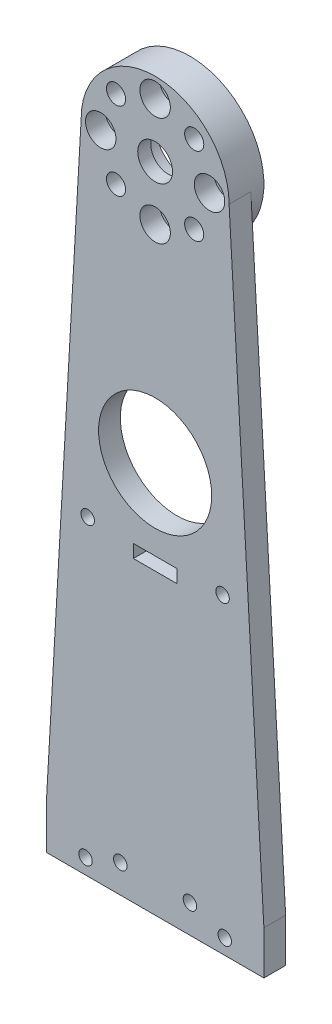
from build123d import *
from build123d.topology import SkipClean

# Parameters (mm, degrees)
SKETCH1_R           = 4
SKETCH1_R_2         = 13
SKETCH1_R_3         = 1.55
SKETCH1_W           = 10
SKETCH1_H           = 3
BOSS_EXTRUDE1_DEPTH = 5
BOSS_EXTRUDE2_START = 3
SKETCH2_R           = 17
BOSS_EXTRUDE2_DEPTH = 3
SKETCH3_R           = 1.55
SKETCH3_R_2         = 1
CUT_EXTRUDE1_DEPTH  = 8
SKETCH4_R           = 3.5
SKETCH4_R_2         = 2.2
CUT_EXTRUDE2_DEPTH  = 4.5
SKETCH5_R           = 8.2
CUT_EXTRUDE3_DEPTH  = 5


with BuildPart() as part:
    # Sketch1 → Boss-Extrude1 (new body)
    with BuildSketch(Plane.XY):
        with BuildLine():
            Line((-25, 0), (25, 0))
            Line((25, 0), (25, 10))
            Line((25, 10), (17, 150))
            ThreePointArc((17, 150), (0, 167), (-17, 150))
            Line((-17, 150), (-25, 10))
            Line((-25, 10), (-25, 0))
        make_face()
        with Locations((0, 150)):
            Circle(SKETCH1_R, mode=Mode.SUBTRACT)
        with Locations((0, 90)):
            Circle(SKETCH1_R_2, mode=Mode.SUBTRACT)
        with Locations((-8, 6.5)):
            Circle(SKETCH1_R_3, mode=Mode.SUBTRACT)
        with Locations((-16, 3.5)):
            Circle(SKETCH1_R_3, mode=Mode.SUBTRACT)
        with Locations((8, 6.5)):
            Circle(SKETCH1_R_3, mode=Mode.SUBTRACT)
        with Locations((16, 3.5)):
            Circle(SKETCH1_R_3, mode=Mode.SUBTRACT)
        with Locations((-15.5, 71.5)):
            Circle(SKETCH1_R_3, mode=Mode.SUBTRACT)
        with Locations((15.5, 71.5)):
            Circle(SKETCH1_R_3, mode=Mode.SUBTRACT)
        with Locations((0, 70)):
            Rectangle(SKETCH1_W, SKETCH1_H, mode=Mode.SUBTRACT)
    extrude(amount=BOSS_EXTRUDE1_DEPTH)

    # Sketch2 → Boss-Extrude2 (add)
    with SkipClean():  # the faces are left unmerged after this step: merging them gives an invalid solid
        with BuildSketch(Plane(origin=(0, 0, 0), x_dir=(-1, 0, 0), z_dir=(0, 0, -1)).offset(BOSS_EXTRUDE2_START)):
            with Locations((0, 150)):
                Circle(SKETCH2_R)
        extrude(amount=-BOSS_EXTRUDE2_DEPTH)

    # Sketch3 → Cut-Extrude1 (cut)
    with SkipClean():  # the faces are left unmerged after this step: merging them gives an invalid solid
        with BuildSketch(Plane.XY.offset(5)):
            with Locations((-12.5, 150)):
                Circle(SKETCH3_R)
            with Locations((0, 162.5)):
                Circle(SKETCH3_R)
            with Locations((12.5, 150)):
                Circle(SKETCH3_R)
            with Locations((0, 137.5)):
                Circle(SKETCH3_R)
            with Locations((8.980256121, 158.980256121)):
                Circle(SKETCH3_R_2)
            with Locations((8.980256121, 141.019743879)):
                Circle(SKETCH3_R_2)
            with Locations((-8.980256121, 141.019743879)):
                Circle(SKETCH3_R_2)
            with Locations((-8.980256121, 158.980256121)):
                Circle(SKETCH3_R_2)
        extrude(amount=-CUT_EXTRUDE1_DEPTH, mode=Mode.SUBTRACT)

    # Sketch4 → Cut-Extrude2 (cut)
    with SkipClean():  # the faces are left unmerged after this step: merging them gives an invalid solid
        with BuildSketch(Plane.XY.offset(5)):
            with Locations((-12.5, 150)):
                Circle(SKETCH4_R)
            with Locations((0, 162.5)):
                Circle(SKETCH4_R)
            with Locations((12.5, 150)):
                Circle(SKETCH4_R)
            with Locations((0, 137.5)):
                Circle(SKETCH4_R)
            with Locations((-8.980256121, 158.980256121)):
                Circle(SKETCH4_R_2)
            with Locations((8.980256121, 158.980256121)):
                Circle(SKETCH4_R_2)
            with Locations((8.980256121, 141.019743879)):
                Circle(SKETCH4_R_2)
            with Locations((-8.980256121, 141.019743879)):
                Circle(SKETCH4_R_2)
        extrude(amount=-CUT_EXTRUDE2_DEPTH, mode=Mode.SUBTRACT)

    # Sketch5 → Cut-Extrude3 (cut)
    with SkipClean():  # the faces are left unmerged after this step: merging them gives an invalid solid
        with BuildSketch(Plane(origin=(0, 0, -3), x_dir=(-1, 0, 0), z_dir=(0, 0, -1))):
            with Locations((0, 150)):
                Circle(SKETCH5_R)
        extrude(amount=-CUT_EXTRUDE3_DEPTH, mode=Mode.SUBTRACT)


solid = part.part
